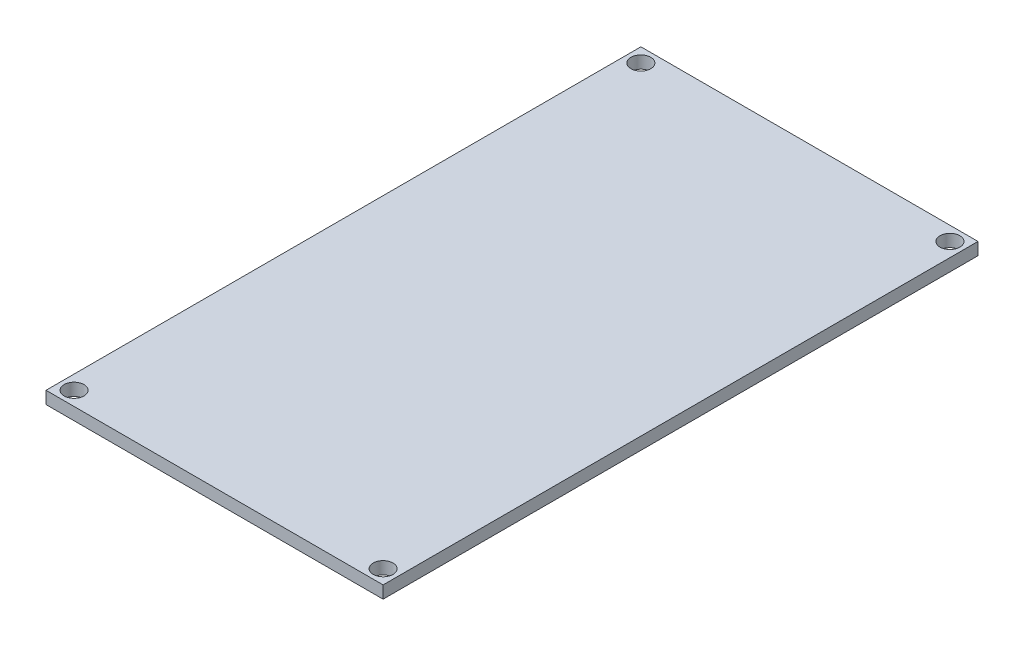
from build123d import *

# Parameters (mm, degrees)
SKETCH3_R           = 1
BOSS_EXTRUDE1_DEPTH = 1.25


with BuildPart() as part:
    # Sketch3 → Boss-Extrude1 (new body)
    with BuildSketch(Plane(origin=(0, 0, 0), x_dir=(1, 0, 0), z_dir=(0, 1, 0))):
        Polygon((-17, 35.809268437), (-17, 26), (-17, -14.381463126), (-17, -24.190731563), (-7.190731563, -24.190731563), (7.190731563, -24.190731563), (17, -24.190731563), (17, -14.381463126), (17, 26), (17, 35.809268437), (7.190731563, 35.809268437), (-7.190731563, 35.809268437), align=None)
        with Locations((-15.585786438, -22.776518001)):
            Circle(SKETCH3_R, mode=Mode.SUBTRACT)
        with Locations((15.585786438, -22.776518001)):
            Circle(SKETCH3_R, mode=Mode.SUBTRACT)
        with Locations((-15.585786438, 34.395054875)):
            Circle(SKETCH3_R, mode=Mode.SUBTRACT)
        with Locations((15.585786438, 34.395054875)):
            Circle(SKETCH3_R, mode=Mode.SUBTRACT)
    extrude(amount=BOSS_EXTRUDE1_DEPTH)


solid = part.part
